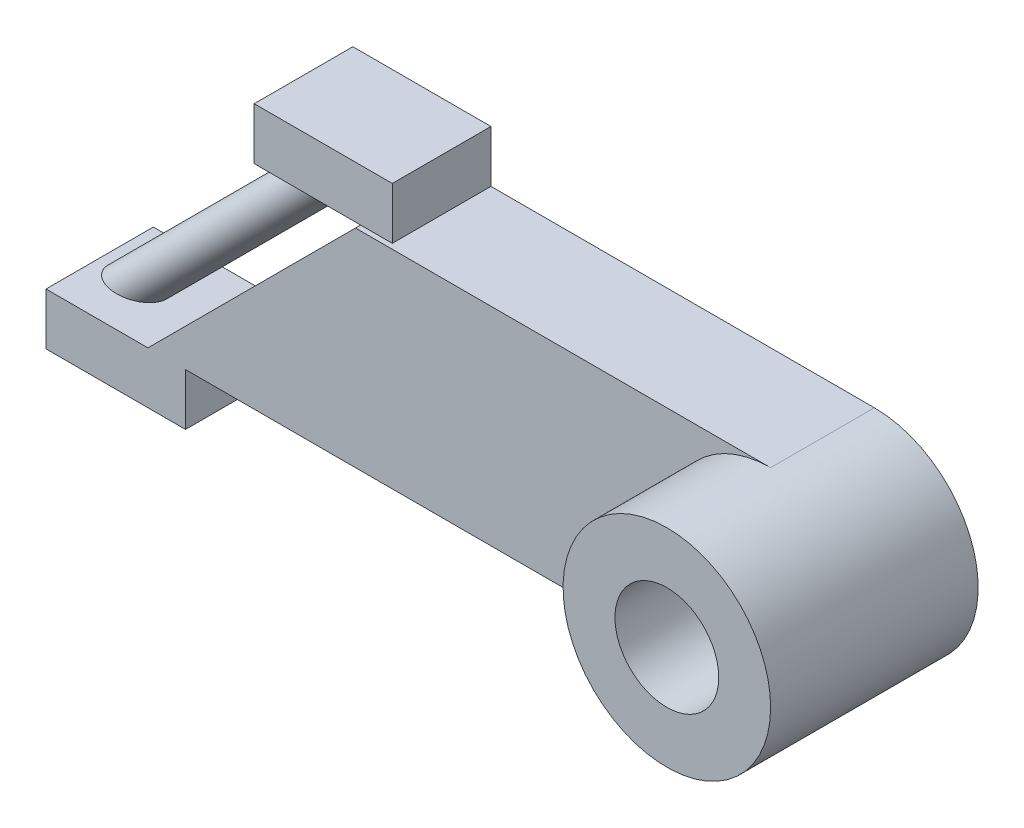
from build123d import *
from build123d.topology import SkipClean

# Parameters (mm, degrees)
ESTRUSIONE_ESTRUSIONE1_DEPTH = 5
SCHIZZO3_R                   = 5
SCHIZZO3_R_2                 = 2.5
ESTRUSIONE_ESTRUSIONE3_DEPTH = 5
SCHIZZO6_R                   = 1
ESTRUSIONE_ESTRUSIONE4_DEPTH = 18
SCHIZZO7_W                   = 6.652483513
SCHIZZO7_H                   = 4.753418725
ESTRUSIONE_ESTRUSIONE5_DEPTH = 2.5
SCHIZZO8_W                   = 6.721118696
SCHIZZO8_H                   = 5.171086791
ESTRUSIONE_ESTRUSIONE6_DEPTH = 2.5


with BuildPart() as part:
    # Schizzo1 → Estrusione-Estrusione1 (new body)
    with BuildSketch(Plane.XY):
        with BuildLine():
            Line((0, 0), (-20, 0))
            Line((-20, 0), (-10, 10))
            Line((-10, 10), (10, 10))
            ThreePointArc((10, 10), (15, 5), (10, 0))
            Line((10, 0), (0, 0))
        make_face()
    extrude(amount=ESTRUSIONE_ESTRUSIONE1_DEPTH)

    # Schizzo3 → Estrusione-Estrusione3 (add)
    with SkipClean():  # the faces are left unmerged after this step: merging them gives an invalid solid
        with BuildSketch(Plane.XY.offset(5)):
            with Locations((10, 5)):
                Circle(SCHIZZO3_R)
            with Locations((10, 5)):
                Circle(SCHIZZO3_R_2, mode=Mode.SUBTRACT)
        extrude(amount=ESTRUSIONE_ESTRUSIONE3_DEPTH)
    add(part.part.scale(1), mode=Mode.REPLACE)  # the faces are merged on a copy



with BuildPart() as body_2:
    # Schizzo6 → Estrusione-Estrusione4 (new body)
    with BuildSketch(Plane(origin=(-1.420848604, -1.420848604, 0), x_dir=(0.33004847671834386, -0.3300484767183458, -0.8843845351609222), z_dir=(0.7071067811865475, 0.7071067811865476, -1.5820678100908477e-15))):
        with Locations((-9.802556855, 13.217161886)):
            Circle(SCHIZZO6_R)
    extrude(amount=-ESTRUSIONE_ESTRUSIONE4_DEPTH)


with BuildPart() as part_1:
    with SkipClean():  # the faces are left unmerged after this step: merging them gives an invalid solid
        add(part.part)

        add(body_2.part)  # Estrusione-Estrusione5 merges body 2
        # Schizzo7 → Estrusione-Estrusione5 (add)
        with BuildSketch(Plane(origin=(0, 10, 0), x_dir=(1, 0, 0), z_dir=(0, 1, 0))):
            with Locations((-11.799980573, -2.376709363)):
                Rectangle(SCHIZZO7_W, SCHIZZO7_H)
        extrude(amount=ESTRUSIONE_ESTRUSIONE5_DEPTH)

    # Schizzo8 → Estrusione-Estrusione6 (add)
    with BuildSketch(Plane.XZ):
        with Locations((-21.550148219, 2.414456604)):
            Rectangle(SCHIZZO8_W, SCHIZZO8_H)
    extrude(amount=ESTRUSIONE_ESTRUSIONE6_DEPTH)


solid = part_1.part
